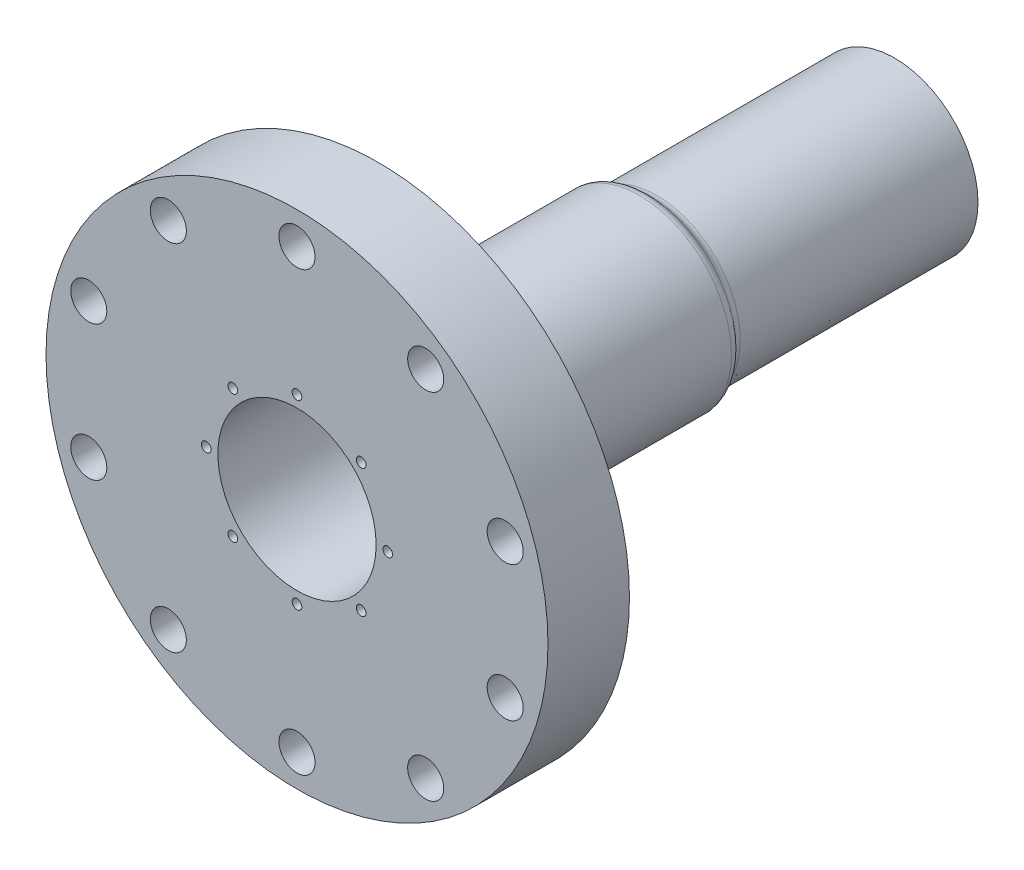
from build123d import *

# Parameters (mm, degrees)
SKETCH1_R                 = 19.5
SKETCH1_R_2               = 18.5
EXTRUDE1_DEPTH            = 139.7
SKETCH4_R                 = 58.674
SKETCH4_R_2               = 19.5
EXTRUDE2_DEPTH            = 19.05
CUT_EXTRUDE1_REACH        = 164.485
SKETCH5_R                 = 4.2164
CIRPATTERN1_COUNT         = 10
F_4_40_TAPPED_HOLE2_D     = 2.2606
F_4_40_TAPPED_HOLE2_DEPTH = 7.62
F_4_40_TAPPED_HOLE2_TIP   = 0.679152758
SKETCH10_R                = 19
EXTRUDE3_DEPTH            = 25.4
EXTRUDE4_START            = 63.5
SKETCH12_R                = 21.5
SKETCH12_R_2              = 19
EXTRUDE4_DEPTH            = 63.5
FILLET1_R                 = 2.54
FILLET2_R                 = 2.54


with BuildPart() as part:
    # Sketch1 → Extrude1 (new body)
    with BuildSketch(Plane.XY):
        Circle(SKETCH1_R)
        Circle(SKETCH1_R_2, mode=Mode.SUBTRACT)
    extrude(amount=-EXTRUDE1_DEPTH)

    # Sketch4 → Extrude2 (add)
    with BuildSketch(Plane.XY):
        Circle(SKETCH4_R)
        Circle(SKETCH4_R_2, mode=Mode.SUBTRACT)
    extrude(amount=-EXTRUDE2_DEPTH)

    # Sketch5 → Cut-Extrude1 (cut, up to next)
    with BuildSketch(Plane.XY, mode=Mode.PRIVATE) as cut_extrude1_sk1:
        with Locations((0, 51.181)):
            Circle(SKETCH5_R)
    cut_extrude1_tool1 = extrude(cut_extrude1_sk1.sketch, amount=-CUT_EXTRUDE1_REACH, mode=Mode.PRIVATE) & part.part
    cut_extrude1 = cut_extrude1_tool1.solids().sort_by_distance((0, 51.181, 0))[0]
    add(cut_extrude1, mode=Mode.SUBTRACT)

    # CirPattern1: Cut-Extrude1 ×10 about axis
    cirpattern1_axis = Axis((0, 0, 0), (0, 0, 1))
    for i in range(1, CIRPATTERN1_COUNT):
        add(cut_extrude1.rotate(cirpattern1_axis, i * 360 / CIRPATTERN1_COUNT), mode=Mode.SUBTRACT)

    # #4-40 Tapped Hole2
    with Locations(Plane.XY):
        with Locations((15, -15), (-15, -15), (-15, 15), (15, 15), (0, 21.213203436), (-21.213203436, 0), (21.213203436, 0), (0, -21.213203436)):
            Hole(F_4_40_TAPPED_HOLE2_D / 2, depth=F_4_40_TAPPED_HOLE2_DEPTH)
            with Locations((0, 0, -(F_4_40_TAPPED_HOLE2_DEPTH + F_4_40_TAPPED_HOLE2_TIP / 2))):  # 118° drill point
                Cone(0, F_4_40_TAPPED_HOLE2_D / 2, F_4_40_TAPPED_HOLE2_TIP, mode=Mode.SUBTRACT)

    # Sketch10 → Extrude3 (cut)
    with BuildSketch(Plane(origin=(0, 0, -139.7), x_dir=(-1, 0, 0), z_dir=(0, 0, -1))):
        Circle(SKETCH10_R)
    extrude(amount=-EXTRUDE3_DEPTH, mode=Mode.SUBTRACT)

    # Sketch11 → Revolve1 (revolve)
    with BuildSketch(Plane(origin=(0, 0, 0), x_dir=(1, 0, 0), z_dir=(0, 1, 0)), mode=Mode.PRIVATE) as revolve1_sk:
        Polygon((-15, 139.7), (-15, 139.2), (-16.440598923, 139.2), (-18.75, 135.2), (-18.75, 130.320377846), (-19.25, 130.320377846), (-19.25, 135.333974596), (-16.729274058, 139.7), align=None)
    revolve(revolve1_sk.sketch.rotate(Axis((0, 0, -123.436944837), (0, 0, -1)), 180), axis=Axis((0, 0, -123.436944837), (0, 0, -1)))

    # Sketch12 → Extrude4 (add)
    with BuildSketch(Plane(origin=(0, 0, -19.05), x_dir=(-1, 0, 0), z_dir=(0, 0, -1)).offset(EXTRUDE4_START)):
        with Locations(Location((0, 0, 0), (0, 0, 180))):
            Circle(SKETCH12_R)
        Circle(SKETCH12_R_2, mode=Mode.SUBTRACT)
    extrude(amount=-EXTRUDE4_DEPTH)

    # Fillet1
    # the kernel refuses this fillet: 2.54 mm, written as the material it takes off along each edge
    with BuildSketch(Plane(origin=(0, 0, -82.55), x_dir=(1, 0, 0), z_dir=(0, 1, 0))) as fillet1_piece_1:
        with BuildLine():
            CenterArc((18.96, -2.481934729), FILLET1_R, 0, 77.725329785)
            Line((21.5, -2.481934729), (21.5508, -2.481934729))
            Line((21.5508, -2.481934729), (21.5508, 0))
            Line((21.5508, 0), (21.5, 0.0508))
            ThreePointArc((21.5, 0.0508), (20.5, 0.0508), (19.5108, 0.049638695))
            Line((19.5108, 0.049638695), (19.5, 0))
        make_face()
    revolve(axis=Axis((0, 0, -82.55), (0, 0, -1)), mode=Mode.SUBTRACT)

    # Fillet2
    fillet2_edges = [part.edges().sort_by_distance(p)[0] for p in [
        (-19.5, 0, -82.55),
    ]]
    fillet(fillet2_edges, radius=FILLET2_R)


solid = part.part
